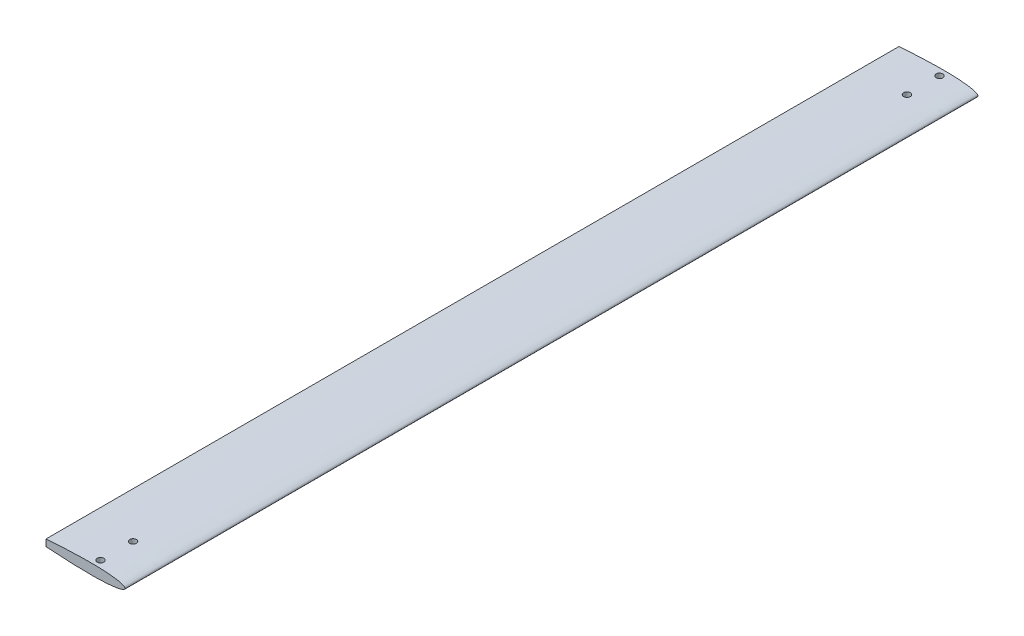
from build123d import *

# Parameters (mm, degrees)
BOSS_EXTRUDE1_DEPTH = 458.7
SKETCH2_R           = 3.6
CUT_EXTRUDE1_DEPTH  = 20


with BuildPart() as part:
    # Sketch1 → Boss-Extrude1 (new, symmetric)
    with BuildSketch(Plane.XY):
        with BuildLine():
            Line((-85.0136, 3.611255895), (-85.0136, -3.611255895))
            add(Edge.make_bspline(
                [(-85.0136, 3.611255895), (-83.951341924, 3.687212386), (-80.78329629, 3.913742676), (-75.460273393, 4.256765094), (-69.021546933, 4.637496418), (-62.511319459, 4.973109559), (-56.001035915, 5.25355183), (-49.561931937, 5.466072373), (-43.264510359, 5.59942564), (-37.177702223, 5.643635145), (-31.368131272, 5.590996212), (-25.899359021, 5.436695431), (-20.831197769, 5.179261939), (-16.218881869, 4.820955991), (-12.112715053, 4.367127754), (-8.556077253, 3.827586713), (-5.587795339, 3.210732895), (-3.229599767, 2.537766722), (-1.506720345, 1.79889853), (-0.35897058, 1.035554005), (0.148408258, 0), (-0.35897058, -1.035554005), (-1.506720345, -1.79889853), (-3.229599767, -2.537766722), (-5.587795339, -3.210732895), (-8.556077253, -3.827586713), (-12.112715053, -4.367127754), (-16.218881869, -4.820955991), (-20.831197769, -5.179261939), (-25.899359021, -5.436695431), (-31.368131272, -5.590996212), (-37.177702223, -5.643635145), (-43.264510359, -5.59942564), (-49.561931937, -5.466072373), (-56.001035915, -5.25355183), (-62.511319459, -4.973109559), (-69.021546933, -4.637496418), (-75.460273393, -4.256765094), (-80.78329629, -3.913742676), (-83.951341924, -3.687212386), (-85.0136, -3.611255895)],
                knots=[0, 0, 0, 0, 0.018499199, 0.055171439, 0.092655195, 0.130538861, 0.168407204, 0.205846372, 0.242448967, 0.277819055, 0.311576982, 0.343363918, 0.372846133, 0.39971914, 0.423712133, 0.444593591, 0.462180115, 0.476353861, 0.487105625, 0.494669113, 0.5, 0.505330887, 0.512894375, 0.523646139, 0.537819885, 0.555406409, 0.576287867, 0.60028086, 0.627153867, 0.656636082, 0.688423018, 0.722180945, 0.757551033, 0.794153628, 0.831592796, 0.869461139, 0.907344805, 0.944828561, 0.981500801, 1, 1, 1, 1], degree=3))
        make_face()
    extrude(amount=BOSS_EXTRUDE1_DEPTH, both=True)

    # Sketch2 → Cut-Extrude1 (cut)
    with BuildSketch(Plane(origin=(0, -10, 0), x_dir=(1, 0, 0), z_dir=(0, 1, 0))):
        with Locations((-33.9, -451.2)):
            Circle(SKETCH2_R)
        with Locations((-33.9, -416.2)):
            Circle(SKETCH2_R)
        with Locations((-33.9, 416.2)):
            Circle(SKETCH2_R)
        with Locations((-33.9, 451.2)):
            Circle(SKETCH2_R)
    extrude(amount=CUT_EXTRUDE1_DEPTH, mode=Mode.SUBTRACT)


solid = part.part
